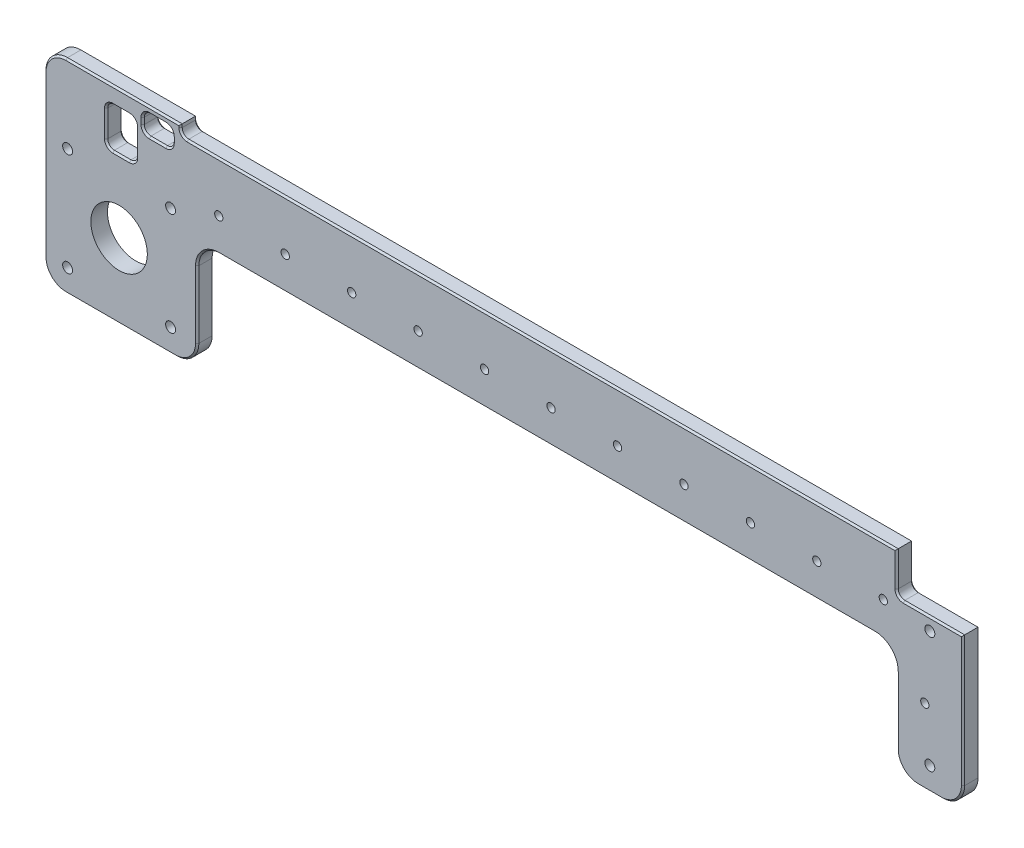
from build123d import *

# Parameters (mm, degrees)
SKETCH1_R           = 1.25
SKETCH1_R_2         = 8.5
SKETCH1_R_3         = 1.5
BOSS_EXTRUDE1_DEPTH = 5
CHAMFER1_SIZE       = 0.5


with BuildPart() as part:
    # Sketch1 → Boss-Extrude1 (new body)
    with BuildSketch(Plane.XY):
        with BuildLine():
            Line((0, -10), (197.5, -10))
            ThreePointArc((197.5, -10), (202.096194078, -11.903805922), (204, -16.5))
            Line((204, -16.5), (204, -36.746197724))
            ThreePointArc((204, -36.746197724), (205.903805922, -41.342391801), (210.5, -43.246197724))
            Line((210.5, -43.246197724), (217.5, -43.246197724))
            ThreePointArc((217.5, -43.246197724), (222.096194078, -41.342391801), (224, -36.746197724))
            Line((224, -36.746197724), (224, 2.55))
            Line((224, 2.55), (206, 2.55))
            ThreePointArc((206, 2.55), (204.585786438, 3.135786438), (204, 4.55))
            Line((204, 4.55), (204, 15))
            Line((204, 15), (-9.5, 15))
            ThreePointArc((-9.5, 15), (-10.914213562, 15.585786438), (-11.5, 17))
            Line((-11.5, 17), (-11.5, 18))
            Line((-11.5, 18), (-46, 18))
            ThreePointArc((-46, 18), (-50.596194078, 16.096194078), (-52.5, 11.5))
            Line((-52.5, 11.5), (-52.5, -36.746197724))
            ThreePointArc((-52.5, -36.746197724), (-50.596194078, -41.342391801), (-46, -43.246197724))
            Line((-46, -43.246197724), (-13, -43.246197724))
            ThreePointArc((-13, -43.246197724), (-8.403805922, -41.342391801), (-6.5, -36.746197724))
            Line((-6.5, -36.746197724), (-6.5, -16.5))
            ThreePointArc((-6.5, -16.5), (-4.596194078, -11.903805922), (0, -10))
        make_face()
        Circle(SKETCH1_R, mode=Mode.SUBTRACT)
        with Locations((20, 0)):
            Circle(SKETCH1_R, mode=Mode.SUBTRACT)
        with Locations((40, 0)):
            Circle(SKETCH1_R, mode=Mode.SUBTRACT)
        with Locations((60, 0)):
            Circle(SKETCH1_R, mode=Mode.SUBTRACT)
        with Locations((80, 0)):
            Circle(SKETCH1_R, mode=Mode.SUBTRACT)
        with Locations((100, 0)):
            Circle(SKETCH1_R, mode=Mode.SUBTRACT)
        with Locations((120, 0)):
            Circle(SKETCH1_R, mode=Mode.SUBTRACT)
        with Locations((140, 0)):
            Circle(SKETCH1_R, mode=Mode.SUBTRACT)
        with Locations((160, 0)):
            Circle(SKETCH1_R, mode=Mode.SUBTRACT)
        with Locations((180, 0)):
            Circle(SKETCH1_R, mode=Mode.SUBTRACT)
        with Locations((-30, -20.746197724)):
            Circle(SKETCH1_R_2, mode=Mode.SUBTRACT)
        with Locations((-45.5, -5.246197724)):
            Circle(SKETCH1_R_3, mode=Mode.SUBTRACT)
        with Locations((-14.5, -5.246197724)):
            Circle(SKETCH1_R_3, mode=Mode.SUBTRACT)
        with Locations((-45.5, -36.246197724)):
            Circle(SKETCH1_R_3, mode=Mode.SUBTRACT)
        with Locations((-14.5, -36.246197724)):
            Circle(SKETCH1_R_3, mode=Mode.SUBTRACT)
        with Locations((200, 0)):
            Circle(SKETCH1_R, mode=Mode.SUBTRACT)
        with Locations((212.5, -20.746197724)):
            Circle(SKETCH1_R, mode=Mode.SUBTRACT)
        with Locations((214, -36.246197724)):
            Circle(SKETCH1_R_3, mode=Mode.SUBTRACT)
        with Locations((214, -1.246197724)):
            Circle(SKETCH1_R_3, mode=Mode.SUBTRACT)
        with BuildLine():
            Line((-20.9, 16), (-15.9, 16))
            ThreePointArc((-15.9, 16), (-14.485786438, 15.414213562), (-13.9, 14))
            Line((-13.9, 14), (-13.9, 12.12))
            ThreePointArc((-13.9, 12.12), (-14.485786438, 10.705786438), (-15.9, 10.12))
            Line((-15.9, 10.12), (-20.9, 10.12))
            ThreePointArc((-20.9, 10.12), (-22.314213562, 10.705786438), (-22.9, 12.12))
            Line((-22.9, 12.12), (-22.9, 14))
            ThreePointArc((-22.9, 14), (-22.314213562, 15.414213562), (-20.9, 16))
        make_face(mode=Mode.SUBTRACT)
        with BuildLine():
            Line((-26.9, 12.9), (-31.9, 12.9))
            ThreePointArc((-31.9, 12.9), (-33.314213562, 12.314213562), (-33.9, 10.9))
            Line((-33.9, 10.9), (-33.9, 2.9))
            ThreePointArc((-33.9, 2.9), (-33.314213562, 1.485786438), (-31.9, 0.9))
            Line((-31.9, 0.9), (-26.9, 0.9))
            ThreePointArc((-26.9, 0.9), (-25.485786438, 1.485786438), (-24.9, 2.9))
            Line((-24.9, 2.9), (-24.9, 10.9))
            ThreePointArc((-24.9, 10.9), (-25.485786438, 12.314213562), (-26.9, 12.9))
        make_face(mode=Mode.SUBTRACT)
    extrude(amount=BOSS_EXTRUDE1_DEPTH)

    # Chamfer1
    chamfer1_edges = [part.edges().sort_by_distance(p)[0] for p in [
        (98.75, -10, 0),
        (-4.596194078, -11.903805922, 0),
        (-6.5, -26.623098862, 0),
        (-8.403805922, -41.342391801, 0),
        (-29.5, -43.246197724, 0),
        (-52.5, -12.623098862, 0),
        (98.75, -10, 5),
        (-4.596194078, -11.903805922, 5),
        (-6.5, -26.623098862, 5),
        (-8.403805922, -41.342391801, 5),
        (-29.5, -43.246197724, 5),
        (-52.5, -12.623098862, 5),
        (224, -17.098098862, 0),
        (222.096194078, -41.342391801, 0),
        (214, -43.246197724, 0),
        (205.903805922, -41.342391801, 0),
        (204, -26.623098862, 0),
        (202.096194078, -11.903805922, 0),
        (224, -17.098098862, 5),
        (222.096194078, -41.342391801, 5),
        (214, -43.246197724, 5),
        (205.903805922, -41.342391801, 5),
        (204, -26.623098862, 5),
        (202.096194078, -11.903805922, 5),
        (-28.75, 18, 0),
        (-28.75, 18, 5),
        (-50.596194078, 16.096194078, 0),
        (-50.596194078, 16.096194078, 5),
        (-11.5, 17.5, 0),
        (97.25, 15, 0),
        (-11.5, 17.5, 5),
        (97.25, 15, 5),
        (-18.4, 16, 5),
        (-22.314213562, 15.414213562, 5),
        (-14.485786438, 15.414213562, 5),
        (-22.9, 13.06, 5),
        (-13.9, 13.06, 5),
        (-22.314213562, 10.705786438, 5),
        (-14.485786438, 10.705786438, 5),
        (-18.4, 10.12, 5),
        (-18.4, 16, 0),
        (-22.314213562, 15.414213562, 0),
        (-14.485786438, 15.414213562, 0),
        (-22.9, 13.06, 0),
        (-13.9, 13.06, 0),
        (-22.314213562, 10.705786438, 0),
        (-14.485786438, 10.705786438, 0),
        (-18.4, 10.12, 0),
        (-50.596194078, -41.342391801, 0),
        (-50.596194078, -41.342391801, 5),
        (-10.914213562, 15.585786438, 0),
        (-10.914213562, 15.585786438, 5),
        (204, 9.775, 5),
        (204.585786438, 3.135786438, 5),
        (215, 2.55, 5),
        (215, 2.55, 0),
        (204.585786438, 3.135786438, 0),
        (204, 9.775, 0),
        (-29.4, 12.9, 0),
        (-33.314213562, 12.314213562, 0),
        (-25.485786438, 12.314213562, 0),
        (-33.9, 6.9, 0),
        (-24.9, 6.9, 0),
        (-33.314213562, 1.485786438, 0),
        (-25.485786438, 1.485786438, 0),
        (-29.4, 0.9, 0),
        (-29.4, 12.9, 5),
        (-33.314213562, 12.314213562, 5),
        (-25.485786438, 12.314213562, 5),
        (-33.9, 6.9, 5),
        (-24.9, 6.9, 5),
        (-33.314213562, 1.485786438, 5),
        (-25.485786438, 1.485786438, 5),
        (-29.4, 0.9, 5),
    ]]
    chamfer(chamfer1_edges, length=CHAMFER1_SIZE)


solid = part.part
